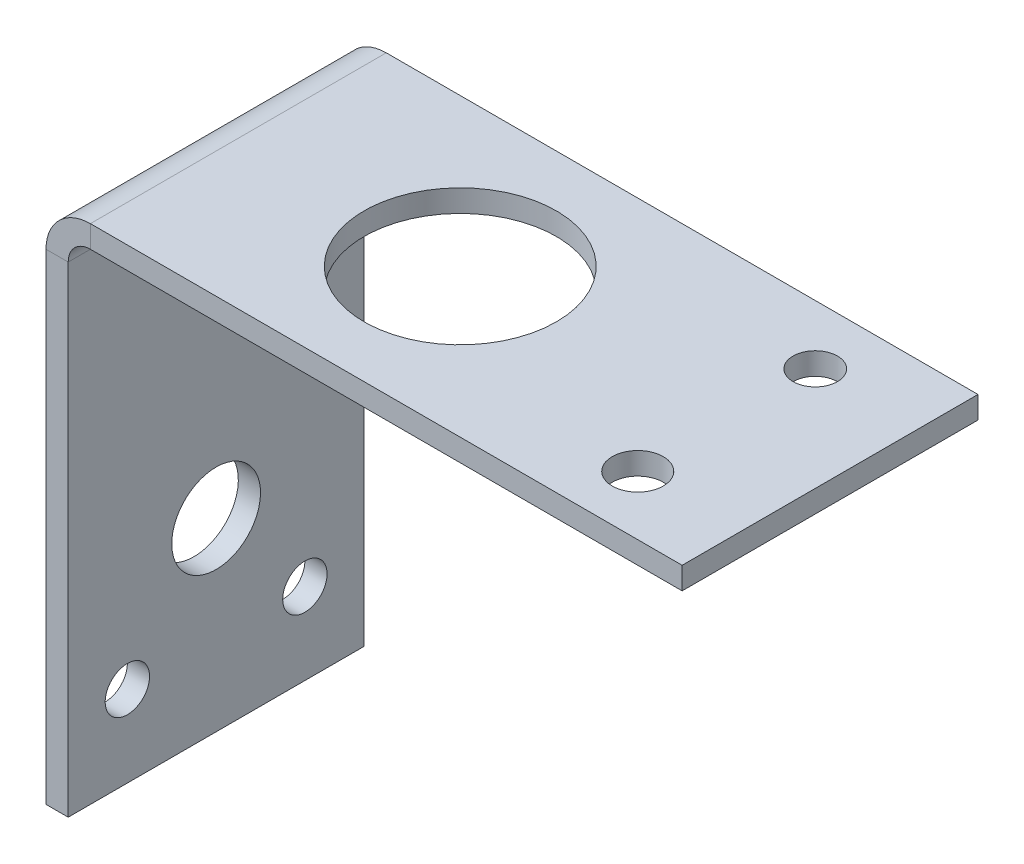
from build123d import *

# Parameters (mm, degrees)
BASE_FLANGE1_DEPTH = 40
SKETCH2_R          = 6
CUT_EXTRUDE1_DEPTH = 115.512008104
SKETCH3_R          = 13
CUT_EXTRUDE2_DEPTH = 117.704755687
SKETCH4_R          = 3
CUT_EXTRUDE3_DEPTH = 10
SKETCH5_R          = 3
SKETCH5_R_2        = 3.446989576
CUT_EXTRUDE4_DEPTH = 10


# Sheet-metal steps are written as plain solids
with BuildPart() as part:
    # Sketch1 → Base-Flange1 (new body)
    with BuildSketch(Plane.XY):
        with BuildLine():
            Line((0, 0), (-80, 0))
            ThreePointArc((-80, 0), (-82.121320344, -0.878679656), (-83, -3))
            Line((-83, -3), (-83, -68))
            Line((-83, -68), (-86, -68))
            Line((-86, -68), (-86, -3))
            ThreePointArc((-86, -3), (-84.242640687, 1.242640687), (-80, 3))
            Line((-80, 3), (0, 3))
            Line((0, 3), (0, 0))
        make_face()
    extrude(amount=BASE_FLANGE1_DEPTH)

    # Sketch2 → Cut-Extrude1 (cut, through all)
    with BuildSketch(Plane(origin=(-83, 0, 0), x_dir=(0, 0, -1), z_dir=(1, 0, 0))):
        with Locations(Location((-20, -43, 0), (0, 0, 90))):
            Circle(SKETCH2_R)
    extrude(amount=-CUT_EXTRUDE1_DEPTH, mode=Mode.SUBTRACT)

    # Sketch3 → Cut-Extrude2 (cut, through all)
    with BuildSketch(Plane.XZ):
        with Locations((-50.000101558, 20)):
            Circle(SKETCH3_R)
    extrude(amount=-CUT_EXTRUDE2_DEPTH, mode=Mode.SUBTRACT)

    # Sketch4 → Cut-Extrude3 (cut)
    with BuildSketch(Plane(origin=(-83, 0, 0), x_dir=(0, 0, -1), z_dir=(1, 0, 0))):
        with Locations(Location((-8, -57, 0), (0, 0, 90))):
            Circle(SKETCH4_R)
        with Locations(Location((-32, -57, 0), (0, 0, 90))):
            Circle(SKETCH4_R)
    extrude(amount=-CUT_EXTRUDE3_DEPTH, mode=Mode.SUBTRACT)

    # Sketch5 → Cut-Extrude4 (cut)
    with BuildSketch(Plane.XZ):
        with Locations((-14, 8)):
            Circle(SKETCH5_R)
        with Locations((-14, 32)):
            Circle(SKETCH5_R_2)
    extrude(amount=-CUT_EXTRUDE4_DEPTH, mode=Mode.SUBTRACT)


solid = part.part
